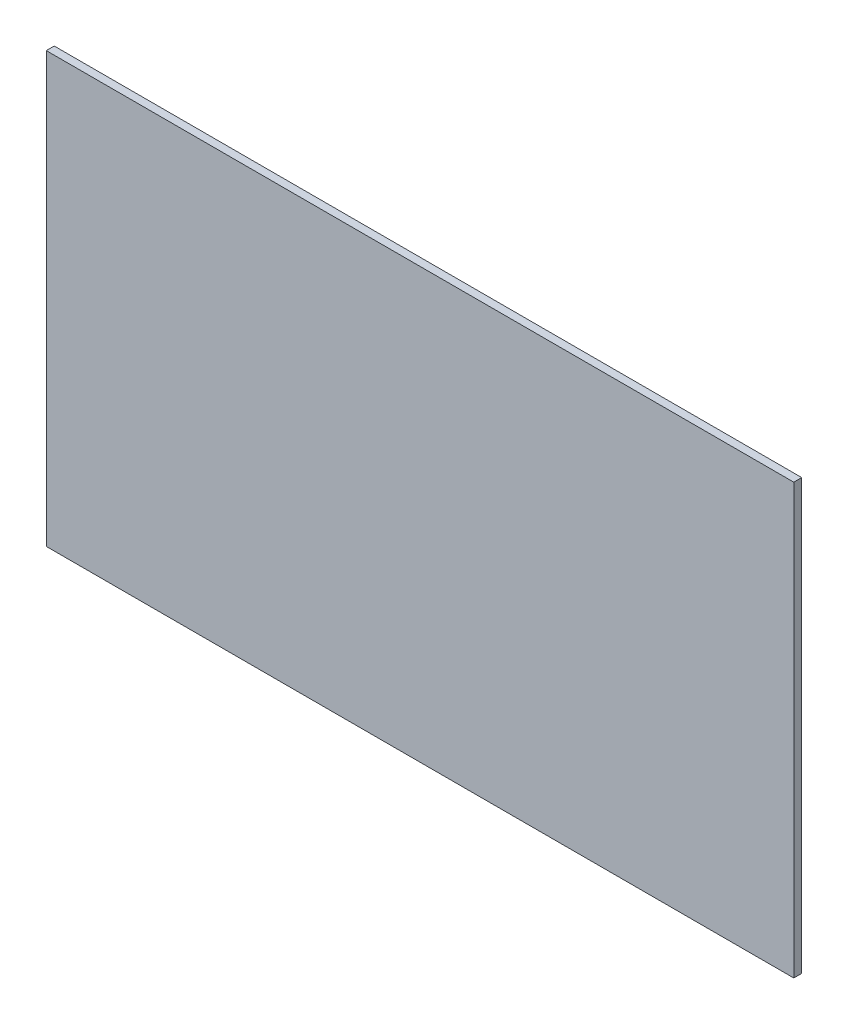
from build123d import *

# Parameters (mm, degrees)
SKETCH1_W           = 298.45
SKETCH1_H           = 171.45
BOSS_EXTRUDE1_DEPTH = 3.175


with BuildPart() as part:
    # Sketch1 → Boss-Extrude1 (new body)
    with BuildSketch(Plane.XY):
        Rectangle(SKETCH1_W, SKETCH1_H)
    extrude(amount=BOSS_EXTRUDE1_DEPTH)


solid = part.part
